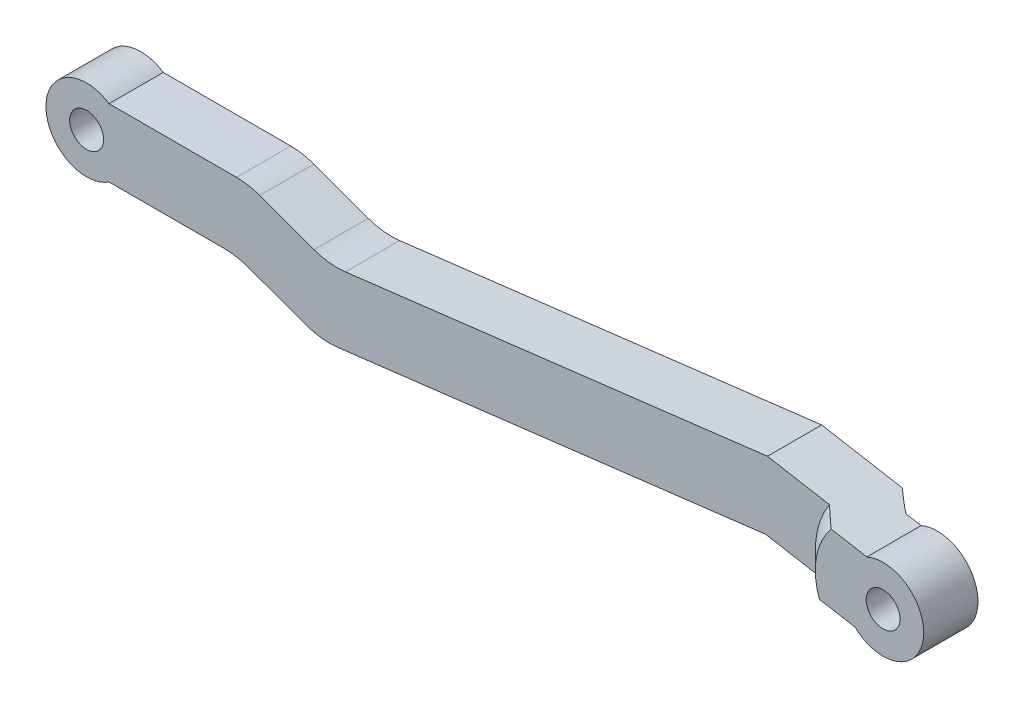
from build123d import *

# Parameters (mm, degrees)
EXTRUDE_1_DEPTH          = 4
SKETCH_2_R               = 10
CUT_EXTRUDE_1_DEPTH      = 2.5
EXTRUDE_4_DEPTH          = 2.5
CUT_EXTRUDE_2_DEPTH      = 127.614708745
CUT_EXTRUDE_2_DEPTH_BACK = 127.614708745
SKETCH_4_R               = 2.5
SKETCH_4_R_2             = 2.500304397
CHAMFER_1_SIZE           = 2.5
CHAMFER_2_SIZE           = 2.5
FILLET_1_R               = 10


with BuildPart() as part:
    # 草图1 → 凸台-拉伸1 (new, symmetric)
    with BuildSketch(Plane.XY):
        with BuildLine():
            Line((-2.397996919, 5.499964616), (-19.561052391, 8.526274367))
            Line((-19.561052391, 8.526274367), (-84.199167791, 0.661766964))
            Line((-84.199167791, 0.661766964), (-96.118365096, 5))
            Line((-96.118365096, 5), (-116.68337521, 5))
            ThreePointArc((-116.68337521, 5), (-126, 0), (-116.68337521, -5))
            Line((-116.68337521, -5), (-97.881634904, -5))
            Line((-97.881634904, -5), (-85.368824069, -9.554290691))
            Line((-85.368824069, -9.554290691), (-19.831257729, -1.58034726))
            Line((-19.831257729, -1.58034726), (-4.134478696, -4.348112914))
            ThreePointArc((-4.134478696, -4.348112914), (5.908846518, -1.041889066), (-2.397996919, 5.499964616))
        make_face()
    extrude(amount=EXTRUDE_1_DEPTH, both=True)

    # 草图2 → 切除-拉伸1 (cut)
    with BuildSketch(Plane(origin=(0, 0, -4), x_dir=(-1, 0, 0), z_dir=(0, 0, -1))):
        Circle(SKETCH_2_R)
    extrude(amount=-CUT_EXTRUDE_1_DEPTH, mode=Mode.SUBTRACT)

    # 草图3 → 凸台-拉伸4 (add)
    with BuildSketch(Plane.XY.offset(4)):
        with BuildLine():
            Line((-2.397996919, 5.499964616), (-7.660444431, 6.427876097))
            ThreePointArc((-7.660444431, 6.427876097), (-9.84807753, 1.736481777), (-9.396926208, -3.420201433))
            Line((-9.396926208, -3.420201433), (-4.134478696, -4.348112914))
            ThreePointArc((-4.134478696, -4.348112914), (5.908846518, -1.041889066), (-2.397996919, 5.499964616))
        make_face()
    extrude(amount=EXTRUDE_4_DEPTH)

    # 草图4 → 切除-拉伸2 (cut, two sides: drawn at the far end of the back side and taken through both)
    with BuildSketch(Plane(origin=(0, 0, -1.5), x_dir=(-1, 0, 0), z_dir=(0, 0, -1)).offset(-CUT_EXTRUDE_2_DEPTH_BACK)):
        Circle(SKETCH_4_R)
        with Locations((120, 0)):
            Circle(SKETCH_4_R_2)
    extrude(amount=CUT_EXTRUDE_2_DEPTH + CUT_EXTRUDE_2_DEPTH_BACK, mode=Mode.SUBTRACT)

    # 倒角1
    chamfer_1_edges = [part.edges().sort_by_distance(p)[0] for p in [
        (-9.84807753, 1.736481777, 4),
    ]]
    chamfer(chamfer_1_edges, length=CHAMFER_1_SIZE - 0.0001)  # a hair under: the kernel refuses the full size

    # 倒角2
    chamfer_2_edges = [part.edges().sort_by_distance(p)[0] for p in [
        (-9.84807753, 1.736481777, -1.5),
    ]]
    chamfer(chamfer_2_edges, length=CHAMFER_2_SIZE - 0.0001)  # a hair under: the kernel refuses the full size

    # 圆角1
    fillet_1_edges = [part.edges().sort_by_distance(p)[0] for p in [
        (-85.368824069, -9.554290691, 0),
        (-97.881634904, -5, 0),
        (-96.118365096, 5, 0),
        (-84.199167791, 0.661766964, 0),
    ]]
    fillet(fillet_1_edges, radius=FILLET_1_R)


solid = part.part
